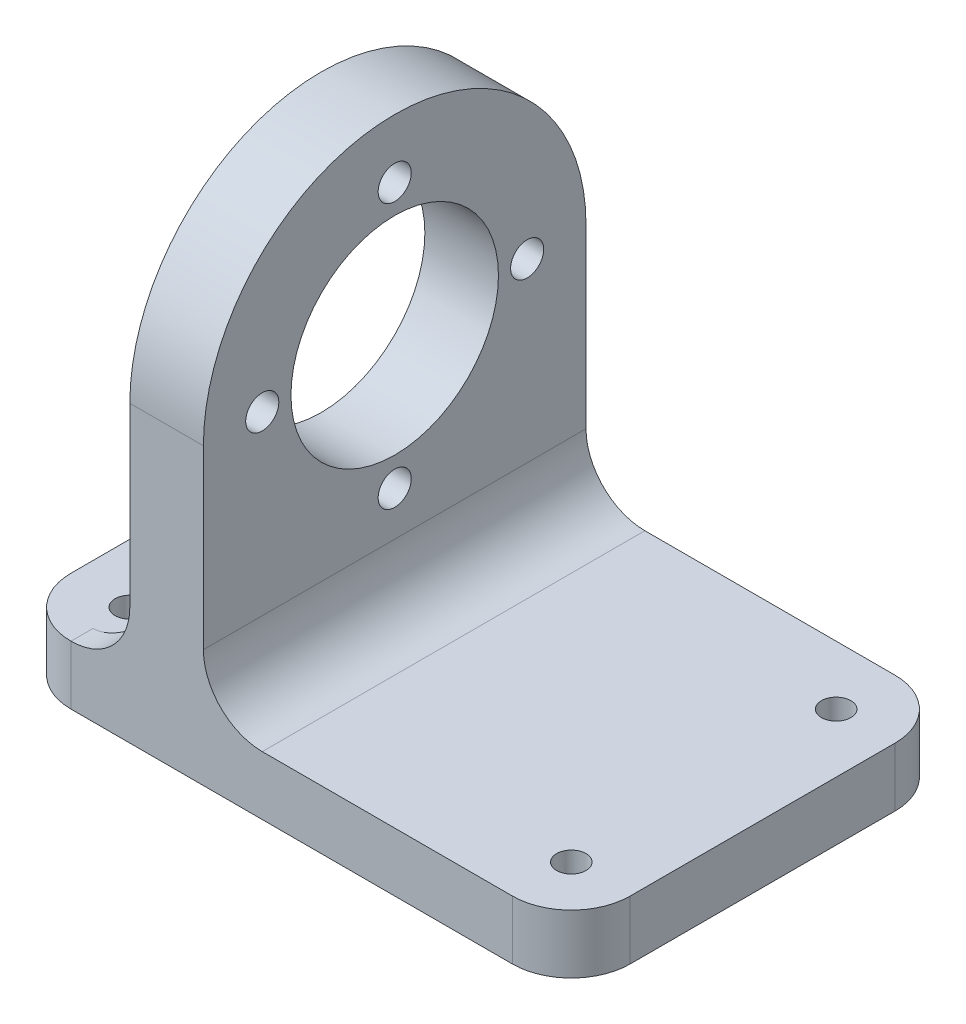
from build123d import *

# Parameters (mm, degrees)
SKETCH1_R                = 1.125
SKETCH1_R_2              = 7.05
BOSS_EXTRUDE1_DEPTH      = 5
BOSS_EXTRUDE2_DEPTH      = 8
BOSS_EXTRUDE2_DEPTH_BACK = 30
SKETCH2_W                = 26
SKETCH2_H                = 4
FILLET1_R                = 4
FILLET2_R                = 4
CUT_EXTRUDE1_DEPTH       = 44.703546767
CUT_EXTRUDE1_DEPTH_BACK  = 44.703546767
SKETCH3_R                = 1
CUT_EXTRUDE3_OUTLINE_R   = 1
CUT_EXTRUDE3_DEPTH       = 4.0000001


with BuildPart() as part:
    # Sketch1 → Boss-Extrude1 (new body)
    with BuildSketch(Plane(origin=(0, 0, 0), x_dir=(0, 0, -1), z_dir=(1, 0, 0))):
        with BuildLine():
            Line((-13, 0), (-13, -20))
            Line((-13, -20), (13, -20))
            Line((13, -20), (13, 0))
            ThreePointArc((13, 0), (0, 13), (-13, 0))
        make_face()
        with Locations((0, 9)):
            Circle(SKETCH1_R, mode=Mode.SUBTRACT)
        with Locations((9, 0)):
            Circle(SKETCH1_R, mode=Mode.SUBTRACT)
        with Locations((0, -9)):
            Circle(SKETCH1_R, mode=Mode.SUBTRACT)
        with Locations((-9, 0)):
            Circle(SKETCH1_R, mode=Mode.SUBTRACT)
        Circle(SKETCH1_R_2, mode=Mode.SUBTRACT)
    extrude(amount=BOSS_EXTRUDE1_DEPTH)

    # Sketch2 → Boss-Extrude2 (add, two sides: drawn at the far end of the back side and taken through both)
    with BuildSketch(Plane.ZY.offset(-BOSS_EXTRUDE2_DEPTH_BACK)):
        with Locations((0, -18)):
            Rectangle(SKETCH2_W, SKETCH2_H)
    extrude(amount=BOSS_EXTRUDE2_DEPTH + BOSS_EXTRUDE2_DEPTH_BACK)

    # Fillet1
    fillet1_edges = [part.edges().sort_by_distance(p)[0] for p in [
        (5, -16, 0),
        (0, -16, 0),
    ]]
    fillet(fillet1_edges, radius=FILLET1_R)

    # Fillet2
    fillet2_edges = [part.edges().sort_by_distance(p)[0] for p in [
        (30, -18, -13),
        (30, -18, 13),
        (-8, -18, -13),
        (-8, -18, 13),
    ]]
    fillet(fillet2_edges, radius=FILLET2_R)

    # Sketch3 → Cut-Extrude1 (cut, two sides: drawn at the far end of the back side and taken through both)
    with BuildSketch(Plane(origin=(0, -16, 0), x_dir=(1, 0, 0), z_dir=(0, 1, 0)).offset(-CUT_EXTRUDE1_DEPTH_BACK)):
        with Locations(Location((-4, -9, 0), (0, 0, 270.000000003))):
            Circle(SKETCH3_R)
        with Locations(Location((-4, 9, 0), (0, 0, 270.000000003))):
            Circle(SKETCH3_R)
        with Locations(Location((26, 9, 0), (0, 0, 270))):
            Circle(SKETCH3_R)
        with Locations(Location((26, -9, 0), (0, 0, 270))):
            Circle(SKETCH3_R)
    extrude(amount=CUT_EXTRUDE1_DEPTH + CUT_EXTRUDE1_DEPTH_BACK, mode=Mode.SUBTRACT)

    # Cut-Extrude3: read off the stored shape, not the designer's step
    # Cut-Extrude3 outline → Cut-Extrude3 (cut)
    with BuildSketch(Plane(origin=(0, -16, 0), x_dir=(1, 0, 0), z_dir=(0, 1, 0))):
        with BuildLine():
            Line((-4, -6.5), (-4, 6.5))
            ThreePointArc((-4, 6.5), (-1.5, 9), (-4, 11.5))
            Line((-4, 11.5), (-4, 13))
            ThreePointArc((-4, 13), (-6.828427125, 11.828427125), (-8, 9))
            Line((-8, 9), (-8, -9))
            ThreePointArc((-8, -9), (-6.828427125, -11.828427125), (-4, -13))
            Line((-4, -13), (-4, -11.5))
            ThreePointArc((-4, -11.5), (-1.5, -9), (-4, -6.5))
        make_face()
        with Locations((-4, -9)):
            Circle(CUT_EXTRUDE3_OUTLINE_R, mode=Mode.SUBTRACT)
        with Locations((-4, 9)):
            Circle(CUT_EXTRUDE3_OUTLINE_R, mode=Mode.SUBTRACT)
    extrude(amount=CUT_EXTRUDE3_DEPTH, mode=Mode.SUBTRACT)


solid = part.part
